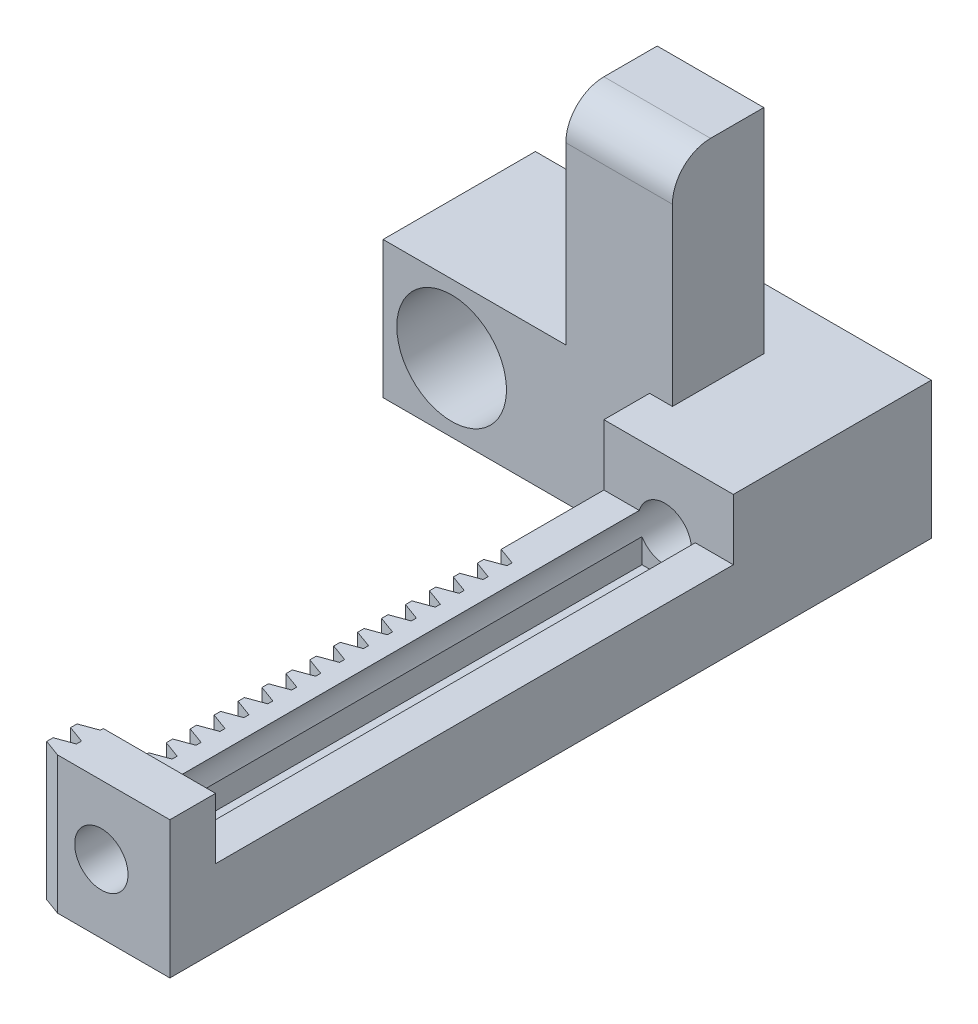
from build123d import *

# Parameters (mm, degrees)
SKETCH_1_W                = 26
SKETCH_1_H                = 9
EXTRUDE_1_DEPTH           = 10
SKETCH_2_R                = 3.6
CUT_EXTRUDE_1_DEPTH       = 18.007351352
EXTRUDE_2_DEPTH           = 26
CUT_EXTRUDE_2_DEPTH       = 7
SKETCH_7_W                = 8.5
SKETCH_7_H                = 9
EXTRUDE_3_DEPTH           = 40
SKETCH_8_R                = 1.75
CUT_EXTRUDE_3_DEPTH       = 40
SKETCH_9_W                = 3.5
SKETCH_9_H                = 34
CUT_EXTRUDE_4_DEPTH       = 7
CUT_EXTRUDE_12_DEPTH      = 50.979995998
PATTERN_START             = -4.5
PATTERN_LINEAR_2_DEPTH    = 9
SKETCH_22_W               = 8.5
SKETCH_22_H               = 34
CUT_EXTRUDE_13_DEPTH      = 4
CUT_EXTRUDE_17_DEPTH      = 58.168610268
CUT_EXTRUDE_17_DEPTH_BACK = 58.168610268
SKETCH_27_W               = 4
SKETCH_27_H               = 28.3452151
CUT_EXTRUDE_18_DEPTH      = 52.168838173
CUT_EXTRUDE_18_DEPTH_BACK = 12
F_2_0MM_1_D               = 1.5
F_2_0MM_1_DEPTH           = 5
F_2_0MM_1_TIP             = 0.450645464
F_2_0MM_2_D               = 1.5
F_2_0MM_2_DEPTH           = 4
F_2_0MM_2_TIP             = 0.450645464


# Read off the part's stored shape, not the designer's step: 阵列(线性)2
with BuildPart() as part:
    # 草图1 → 凸台-拉伸1 (new body)
    with BuildSketch(Plane.XY):
        Rectangle(SKETCH_1_W, SKETCH_1_H)
    extrude(amount=-EXTRUDE_1_DEPTH)

    # 草图2 → 切除-拉伸1 (cut, through all)
    with BuildSketch(Plane.XY):
        with Locations((8.5, 0)):
            Circle(SKETCH_2_R)
        with Locations(Location((-8.5, 0, 0), (0, 0, 180))):
            Circle(SKETCH_2_R)
    extrude(amount=-CUT_EXTRUDE_1_DEPTH, mode=Mode.SUBTRACT)

    # 草图5 → 凸台-拉伸2 (add, through all)
    with BuildSketch(Plane.ZY.offset(13)):
        with BuildLine():
            Line((0, 4.5), (-10, 4.5))
            Line((-10, 4.5), (-10, 8.301419967))
            Line((-10, 8.301419967), (-10, 30.5))
            ThreePointArc((-10, 30.5), (-9.707106781, 31.207106781), (-9, 31.5))
            Line((-9, 31.5), (-8, 31.5))
            Line((-8, 31.5), (-8, 20.1))
            ThreePointArc((-8, 20.1), (-7.53137085, 18.96862915), (-6.4, 18.5))
            Line((-6.4, 18.5), (-2.5, 18.5))
            ThreePointArc((-2.5, 18.5), (-0.732233047, 17.767766953), (0, 16))
            Line((0, 16), (0, 4.5))
        make_face()
    extrude(amount=-EXTRUDE_2_DEPTH)

    # 草图5<2> → 切除-拉伸2 (cut)
    with BuildSketch(Plane.ZY.offset(13)):
        with BuildLine():
            Line((0, 4.5), (-10, 4.5))
            Line((-10, 4.5), (-10, 8.301419967))
            Line((-10, 8.301419967), (-10, 30.5))
            ThreePointArc((-10, 30.5), (-9.707106781, 31.207106781), (-9, 31.5))
            Line((-9, 31.5), (-8, 31.5))
            Line((-8, 31.5), (-8, 20.1))
            ThreePointArc((-8, 20.1), (-7.53137085, 18.96862915), (-6.4, 18.5))
            Line((-6.4, 18.5), (-2.5, 18.5))
            ThreePointArc((-2.5, 18.5), (-0.732233047, 17.767766953), (0, 16))
            Line((0, 16), (0, 4.5))
        make_face()
    cut_extrude_2 = extrude(amount=-CUT_EXTRUDE_2_DEPTH, mode=Mode.SUBTRACT)

    # 镜向1: 切除-拉伸2 across plane
    add(cut_extrude_2.mirror(Plane(origin=(0, 0, 0), x_dir=(0, 0, 1), z_dir=(1, 0, 0))), mode=Mode.SUBTRACT)

    # 草图7 → 凸台-拉伸3 (add)
    with BuildSketch(Plane.XY):
        with Locations((8.75, 0)):
            Rectangle(SKETCH_7_W, SKETCH_7_H)
    extrude(amount=EXTRUDE_3_DEPTH)

    # 草图8 → 切除-拉伸3 (cut)
    with BuildSketch(Plane.XY.offset(40)):
        with Locations((8.5, 0)):
            Circle(SKETCH_8_R)
    extrude(amount=-CUT_EXTRUDE_3_DEPTH, mode=Mode.SUBTRACT)

    # 草图9 → 切除-拉伸4 (cut)
    with BuildSketch(Plane(origin=(0, 4.5, 0), x_dir=(1, 0, 0), z_dir=(0, 1, 0))):
        with Locations((8.75, -20)):
            Rectangle(SKETCH_9_W, SKETCH_9_H)
    extrude(amount=-CUT_EXTRUDE_4_DEPTH, mode=Mode.SUBTRACT)

    # 草图10 → 切除-拉伸12 (cut, through all)
    with BuildSketch(Plane(origin=(0, 4.5, 0), x_dir=(1, 0, 0), z_dir=(0, 1, 0))):
        Polygon((5.625, -40), (5.625, -40.330435371), (4.5, -40.739901884), (4.5, -39.590533486), align=None)
    extrude(amount=-CUT_EXTRUDE_12_DEPTH, mode=Mode.SUBTRACT)

    # 阵列(线性)2 outline → 阵列(线性)2 (cut)
    with BuildSketch(Plane(origin=(0, 0, 0), x_dir=(1, 0, 0), z_dir=(0, 1, 0)).offset(PATTERN_START)):
        Polygon((5.625, -10.485305161), (5.625, -10.154869791), (4.5, -9.745403277), (4.5, -10.894771675), align=None)
        Polygon((5.625, -38.429203673), (4.5, -38.01973716), (4.5, -39.169105557), (5.625, -38.759639044), align=None)
        Polygon((5.625, -36.858407346), (4.5, -36.448940833), (4.5, -37.598309231), (5.625, -37.188842717), align=None)
        Polygon((5.625, -35.28761102), (4.5, -34.878144506), (4.5, -36.027512904), (5.625, -35.61804639), align=None)
        Polygon((5.625, -33.716814693), (4.5, -33.307348179), (4.5, -34.456716577), (5.625, -34.047250063), align=None)
        Polygon((5.625, -32.146018366), (4.5, -31.736551852), (4.5, -32.88592025), (5.625, -32.476453737), align=None)
        Polygon((5.625, -30.575222039), (4.5, -30.165755526), (4.5, -31.315123923), (5.625, -30.90565741), align=None)
        Polygon((5.625, -29.004425712), (4.5, -28.594959199), (4.5, -29.744327597), (5.625, -29.334861083), align=None)
        Polygon((5.625, -27.433629386), (4.5, -27.024162872), (4.5, -28.17353127), (5.625, -27.764064756), align=None)
        Polygon((5.625, -25.862833059), (4.5, -25.453366545), (4.5, -26.602734943), (5.625, -26.193268429), align=None)
        Polygon((5.625, -24.292036732), (4.5, -23.882570219), (4.5, -25.031938616), (5.625, -24.622472103), align=None)
        Polygon((5.625, -22.721240405), (4.5, -22.311773892), (4.5, -23.461142289), (5.625, -23.051675776), align=None)
        Polygon((5.625, -21.150444078), (4.5, -20.740977565), (4.5, -21.890345963), (5.625, -21.480879449), align=None)
        Polygon((5.625, -19.579647752), (4.5, -19.170181238), (4.5, -20.319549636), (5.625, -19.910083122), align=None)
        Polygon((5.625, -18.008851425), (4.5, -17.599384911), (4.5, -18.748753309), (5.625, -18.339286795), align=None)
        Polygon((5.625, -16.438055098), (4.5, -16.028588585), (4.5, -17.177956982), (5.625, -16.768490469), align=None)
        Polygon((5.625, -14.867258771), (4.5, -14.457792258), (4.5, -15.607160655), (5.625, -15.197694142), align=None)
        Polygon((5.625, -13.296462444), (4.5, -12.886995931), (4.5, -14.036364329), (5.625, -13.626897815), align=None)
        Polygon((5.625, -11.725666118), (4.5, -11.316199604), (4.5, -12.465568002), (5.625, -12.056101488), align=None)
    extrude(amount=PATTERN_LINEAR_2_DEPTH, mode=Mode.SUBTRACT)

    # 草图22 → 切除-拉伸13 (cut)
    with BuildSketch(Plane(origin=(0, 4.5, 0), x_dir=(1, 0, 0), z_dir=(0, 1, 0))):
        with Locations((8.75, -20)):
            Rectangle(SKETCH_22_W, SKETCH_22_H)
    extrude(amount=-CUT_EXTRUDE_13_DEPTH, mode=Mode.SUBTRACT)

    # 草图27 → 切除-拉伸17 (cut, two sides: drawn at the far end of the back side and taken through both)
    with BuildSketch(Plane.ZY.offset(13).offset(-CUT_EXTRUDE_17_DEPTH_BACK)):
        with Locations((-8, 18.67260755)):
            Rectangle(SKETCH_27_W, SKETCH_27_H)
    extrude(amount=CUT_EXTRUDE_17_DEPTH + CUT_EXTRUDE_17_DEPTH_BACK, mode=Mode.SUBTRACT)

    # 草图5<5> → 切除-拉伸18 (cut, two sides: drawn at the far end of the back side and taken through both)
    with BuildSketch(Plane.ZY.offset(13).offset(-CUT_EXTRUDE_18_DEPTH_BACK)):
        with BuildLine():
            Line((0, 4.5), (-10, 4.5))
            Line((-10, 4.5), (-10, 8.301419967))
            Line((-10, 8.301419967), (-10, 30.5))
            ThreePointArc((-10, 30.5), (-9.707106781, 31.207106781), (-9, 31.5))
            Line((-9, 31.5), (-8, 31.5))
            Line((-8, 31.5), (-8, 20.1))
            ThreePointArc((-8, 20.1), (-7.53137085, 18.96862915), (-6.4, 18.5))
            Line((-6.4, 18.5), (-2.5, 18.5))
            ThreePointArc((-2.5, 18.5), (-0.732233047, 17.767766953), (0, 16))
            Line((0, 16), (0, 4.5))
        make_face()
    extrude(amount=CUT_EXTRUDE_18_DEPTH + CUT_EXTRUDE_18_DEPTH_BACK, mode=Mode.SUBTRACT)

    # Ø2.0mm 暗销孔1
    with Locations(Plane(origin=(0, 0, -6), x_dir=(-1, 0, 0), z_dir=(0, 0, -1))):
        with Locations((-2.5, 13.5), (-2.5, 8.5)):
            Hole(F_2_0MM_1_D / 2, depth=F_2_0MM_1_DEPTH)
            with Locations((0, 0, -(F_2_0MM_1_DEPTH + F_2_0MM_1_TIP / 2))):  # 118° drill point
                Cone(0, F_2_0MM_1_D / 2, F_2_0MM_1_TIP, mode=Mode.SUBTRACT)

    # Ø2.0mm 暗销孔2
    with Locations(Plane.ZY.offset(1)):
        with Locations((-3, 11)):
            Hole(F_2_0MM_2_D / 2, depth=F_2_0MM_2_DEPTH)
            with Locations((0, 0, -(F_2_0MM_2_DEPTH + F_2_0MM_2_TIP / 2))):  # 118° drill point
                Cone(0, F_2_0MM_2_D / 2, F_2_0MM_2_TIP, mode=Mode.SUBTRACT)


solid = part.part
